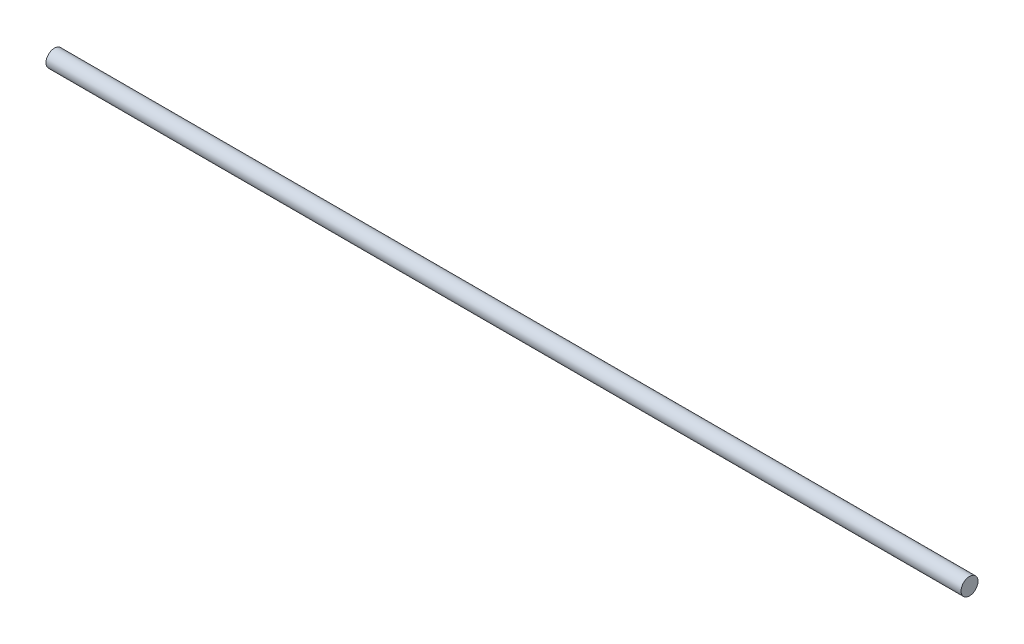
from build123d import *

# Parameters (mm, degrees)
SKETCH1_R           = 5
BOSS_EXTRUDE1_DEPTH = 540


with BuildPart() as part:
    # Sketch1 → Boss-Extrude1 (new body)
    with BuildSketch(Plane(origin=(0, 0, 0), x_dir=(0, 0, -1), z_dir=(1, 0, 0))):
        Circle(SKETCH1_R)
    extrude(amount=BOSS_EXTRUDE1_DEPTH)


solid = part.part
